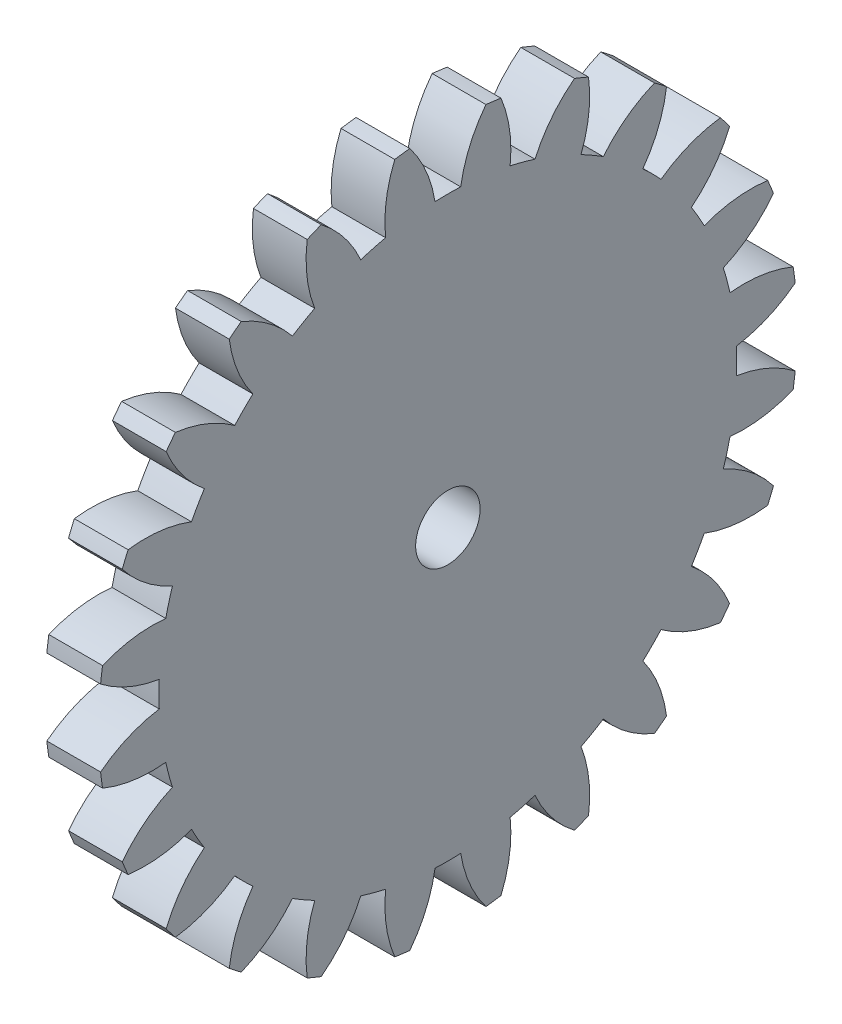
from build123d import *

# Parameters (mm, degrees)
BASPROSKE_W     = 5
BASPROSKE_H     = 32.5
TOOTHCUT_DEPTH  = 47.233105022
TEETHCUTS_COUNT = 24
TEETHCUTS_ANGLE = 345
BORSKE_R        = 3
BORE_DEPTH      = 50.0000508


with BuildPart() as part:
    # BasProSke → Base-Revolve (revolve)
    with BuildSketch(Plane(origin=(0, 0, 0), x_dir=(1, 0, 0), z_dir=(0, 1, 0))):
        with Locations((2.5, 16.25)):
            Rectangle(BASPROSKE_W, BASPROSKE_H)
    revolve(axis=Axis((-10, 0, 0), (1, 0, 0)))

    # TooCutSke → ToothCut (cut, through all)
    with BuildSketch(Plane(origin=(0, 0, 0), x_dir=(0, 0, -1), z_dir=(1, 0, 0))):
        with BuildLine():
            ThreePointArc((1.196304146, 26.847359877), (0, 26.874), (-1.196304146, 26.847359877))
            ThreePointArc((-1.196304146, 26.847359877), (-2.031613036, 29.738020513), (-3.559760234, 32.33001318))
            ThreePointArc((-3.559760234, 32.33001318), (0, 32.5254), (3.559760234, 32.33001318))
            ThreePointArc((3.559760234, 32.33001318), (2.031613036, 29.738020513), (1.196304146, 26.847359877))
        make_face()
    toothcut = extrude(amount=TOOTHCUT_DEPTH, mode=Mode.SUBTRACT)

    # TeethCuts: ToothCut ×24 about axis
    teethcuts_axis = Axis((-10, 0, 0), (1, 0, 0))
    for i in range(1, TEETHCUTS_COUNT):
        add(toothcut.rotate(teethcuts_axis, i * TEETHCUTS_ANGLE / (TEETHCUTS_COUNT - 1)), mode=Mode.SUBTRACT)

    # BorSke → Bore (cut, symmetric)
    with BuildSketch(Plane(origin=(0, 0, 0), x_dir=(0, 0, -1), z_dir=(1, 0, 0))):
        Circle(BORSKE_R)
    extrude(amount=BORE_DEPTH, both=True, mode=Mode.SUBTRACT)


solid = part.part
